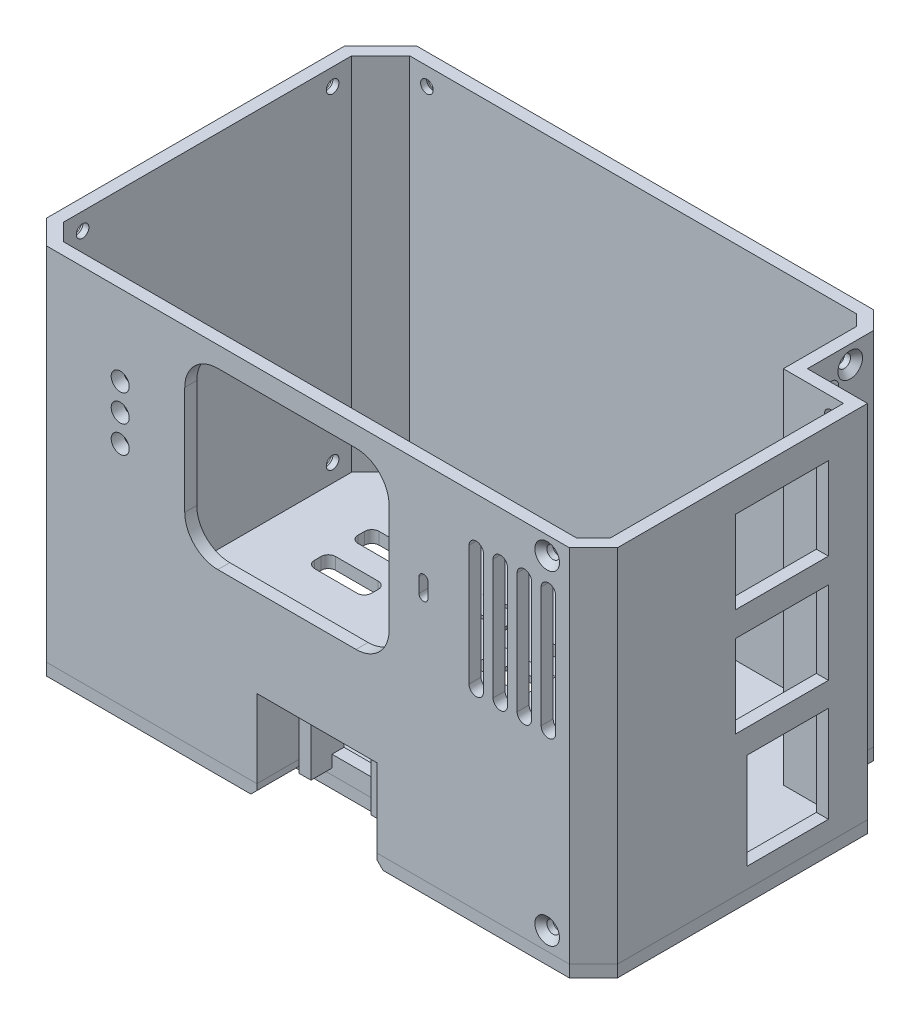
from build123d import *
from OCP.BRepFilletAPI import BRepFilletAPI_MakeChamfer

# Parameters (mm, degrees)
SKETCH_1_W           = 95
SKETCH_1_H           = 62
EXTRUDE_1_DEPTH      = 59.6
CUT_EXTRUDE_3_REACH  = 138.125
SKETCH_4_W           = 10
SKETCH_4_H           = 14
CHAMFER_2_SIZE       = 6
CHAMFER_3_SIZE       = 4
SKETCH_7_W           = 20
SKETCH_7_H           = 20
CUT_EXTRUDE_5_DEPTH  = 7.5
SHELL_3_T            = -2
SKETCH_9_W           = 20
SKETCH_9_H           = 5.5
CUT_EXTRUDE_6_DEPTH  = 10
SKETCH_10_W          = 20
SKETCH_10_H          = 2
EXTRUDE_2_DEPTH      = 5
SKETCH_11_W          = 34
SKETCH_11_H          = 29
CUT_EXTRUDE_7_DEPTH  = 34.5
FILLET_5_R           = 5.5
SKETCH_12_W          = 14
SKETCH_12_H          = 19
EXTRUDE_3_DEPTH      = 3.5
SKETCH_13_W          = 10
SKETCH_13_H          = 5.5
CUT_EXTRUDE_8_DEPTH  = 17
SKETCH_14_W          = 10
SKETCH_14_H          = 19
CUT_EXTRUDE_9_DEPTH  = 3.5
CHAMFER_4_SIZE       = 1
SKETCH_15_W          = 13.55
SKETCH_15_H          = 16
SKETCH_15_W_2        = 15.5
SKETCH_15_H_2        = 13.76
CUT_EXTRUDE_10_DEPTH = 2
CUT_EXTRUDE_11_DEPTH = 2
SKETCH_17_W          = 9.5
SKETCH_17_H          = 3.5
SKETCH_17_W_2        = 6.6
SKETCH_17_H_2        = 3.222886834
SKETCH_17_H_3        = 3.335283253
SKETCH_17_W_3        = 7
SKETCH_17_H_4        = 4.033222468
SKETCH_17_W_4        = 7.58
SKETCH_17_H_5        = 2.8
SKETCH_17_W_5        = 10.642604823
SKETCH_17_H_6        = 1.8
CUT_EXTRUDE_12_DEPTH = 2
CHAMFER_9_SIZE       = 1
FILLET_2_R           = 1.2
FILLET_3_R           = 0.5
CHAMFER_7_SIZE       = 1
SKETCH_18_R          = 1.5
CUT_EXTRUDE_13_DEPTH = 2
SKETCH_20_W          = 6.5
SKETCH_20_H          = 3.033222468
EXTRUDE_4_DEPTH      = 1
SKETCH_21_W          = 4
SKETCH_21_H          = 3.033222468
EXTRUDE_5_DEPTH      = 1
FILLET_4_R           = 0.5
CHAMFER_10_SIZE      = 1.8
CHAMFER_11_SIZE      = 3
CUT_EXTRUDE_15_REACH = 111.846
CUT_EXTRUDE_18_REACH = 119.755
SKETCH_29_R          = 1.05
CUT_EXTRUDE_19_REACH = 128.393
SKETCH_30_R          = 1.05
CUT_EXTRUDE_20_REACH = 111.846
SKETCH_31_R          = 1.05
CUT_EXTRUDE_21_REACH = 122.425
SKETCH_32_R          = 1.05
CUT_EXTRUDE_22_REACH = 128.393
SKETCH_33_R          = 1.05
CHAMFER_20_SIZE      = 1
CUT_EXTRUDE_26_REACH = 128.393
CHAMFER_21_SIZE      = 2
CHAMFER_21_SIZE2     = 9.409260219


# Read off the part's stored shape, not the designer's step: 分割1
with BuildPart() as part:
    # 草图1 → 凸台-拉伸1 (new body)
    with BuildSketch(Plane.XY):
        with Locations((-58.017381047, 4.902672836)):
            Rectangle(SKETCH_1_W, SKETCH_1_H)
    extrude(amount=EXTRUDE_1_DEPTH)

    # 草图4 → 切除-拉伸3 (cut, up to next)
    with BuildSketch(Plane.XZ.offset(26.097327164), mode=Mode.PRIVATE) as cut_extrude_3_sk1:
        with Locations((-15.517381047, 7)):
            Rectangle(SKETCH_4_W, SKETCH_4_H)
    cut_extrude_3_tool1 = extrude(cut_extrude_3_sk1.sketch, amount=-CUT_EXTRUDE_3_REACH, mode=Mode.PRIVATE) & part.part
    add(cut_extrude_3_tool1.solids().sort_by_distance((-15.517381, -26.097327, 7))[0], mode=Mode.SUBTRACT)

    # 倒角2
    chamfer_2_edges = [part.edges().sort_by_distance(p)[0] for p in [
        (-105.517381047, 4.902672836, 0),
    ]]
    chamfer(chamfer_2_edges, length=CHAMFER_2_SIZE)

    # 倒角3
    chamfer_3_edges = [part.edges().sort_by_distance(p)[0] for p in [
        (-10.517381047, 4.902672836, 59.6),
        (-105.517381047, 4.902672836, 59.6),
    ]]
    chamfer(chamfer_3_edges, length=CHAMFER_3_SIZE)

    # 草图7 → 切除-拉伸5 (cut)
    with BuildSketch(Plane.XY.offset(59.6)):
        with Locations((-56.517381047, -16.097327164)):
            Rectangle(SKETCH_7_W, SKETCH_7_H)
    extrude(amount=-CUT_EXTRUDE_5_DEPTH, mode=Mode.SUBTRACT)

    # 抽壳3
    shell_3_openings = [part.faces().sort_by_distance(p)[0] for p in [
        (-58.952330027, 35.902672836, 30.389820214),
    ]]
    offset(amount=SHELL_3_T, openings=shell_3_openings, kind=Kind.INTERSECTION)

    # 草图9 → 切除-拉伸6 (cut)
    with BuildSketch(Plane.XZ.offset(6.097327164)):
        with Locations((-56.517381047, 54.85)):
            Rectangle(SKETCH_9_W, SKETCH_9_H)
    extrude(amount=-CUT_EXTRUDE_6_DEPTH, mode=Mode.SUBTRACT)

    # 草图10 → 凸台-拉伸2 (add)
    with BuildSketch(Plane.XZ.offset(6.097327164)):
        with Locations((-56.517381047, 58.6)):
            Rectangle(SKETCH_10_W, SKETCH_10_H)
    extrude(amount=EXTRUDE_2_DEPTH)

    # 草图11 → 切除-拉伸7 (cut)
    with BuildSketch(Plane.XY.offset(59.6)):
        with Locations((-61.517381047, 18.002672836)):
            Rectangle(SKETCH_11_W, SKETCH_11_H)
    extrude(amount=-CUT_EXTRUDE_7_DEPTH, mode=Mode.SUBTRACT)

    # 圆角5
    fillet_5_edges = [part.edges().sort_by_distance(p)[0] for p in [
        (-44.517381047, 32.502672836, 58.6),
        (-44.517381047, 3.502672836, 58.6),
        (-78.517381047, 3.502672836, 58.6),
        (-78.517381047, 32.502672836, 58.6),
    ]]
    fillet(fillet_5_edges, radius=FILLET_5_R)

    # 草图12 → 凸台-拉伸3 (add)
    with BuildSketch(Plane.XY.offset(52.1)):
        with Locations((-56.517381047, -13.597327164)):
            Rectangle(SKETCH_12_W, SKETCH_12_H)
    extrude(amount=EXTRUDE_3_DEPTH)

    # 草图13 → 切除-拉伸8 (cut)
    with BuildSketch(Plane(origin=(0, -4.097327164, 0), x_dir=(1, 0, 0), z_dir=(0, 1, 0))):
        with Locations((-56.517381047, -52.85)):
            Rectangle(SKETCH_13_W, SKETCH_13_H)
    extrude(amount=-CUT_EXTRUDE_8_DEPTH, mode=Mode.SUBTRACT)

    # 草图14 → 切除-拉伸9 (cut)
    with BuildSketch(Plane.XY.offset(55.6)):
        with Locations((-56.517381047, -13.597327164)):
            Rectangle(SKETCH_14_W, SKETCH_14_H)
    extrude(amount=-CUT_EXTRUDE_9_DEPTH, mode=Mode.SUBTRACT)

    # 倒角4
    chamfer_4_edges = [part.edges().sort_by_distance(p)[0] for p in [
        (-46.517381047, -26.097327164, 55.85),
        (-66.517381047, -26.097327164, 55.85),
    ]]
    chamfer(chamfer_4_edges, length=CHAMFER_4_SIZE)

    # 草图15 → 切除-拉伸10 (cut)
    with BuildSketch(Plane(origin=(-10.517381047, 0, 0), x_dir=(0, 0, -1), z_dir=(1, 0, 0))):
        with Locations((-27.275, -12.777327164)):
            Rectangle(SKETCH_15_W, SKETCH_15_H)
        with Locations((-28.25, 6.122672836)):
            Rectangle(SKETCH_15_W_2, SKETCH_15_H_2)
        with Locations((-28.25, 24.022672836)):
            Rectangle(SKETCH_15_W_2, SKETCH_15_H_2)
    extrude(amount=-CUT_EXTRUDE_10_DEPTH, mode=Mode.SUBTRACT)

    # 草图16 → 切除-拉伸11 (cut)
    with BuildSketch(Plane.XY.offset(59.6)):
        with BuildLine():
            Line((-38.044404675, 19.202672836), (-38.044404675, 16.802672836))
            ThreePointArc((-38.044404675, 16.802672836), (-38.797381047, 16.049696464), (-39.55035742, 16.802672836))
            Line((-39.55035742, 16.802672836), (-39.55035742, 19.202672836))
            ThreePointArc((-39.55035742, 19.202672836), (-38.797381047, 19.955649209), (-38.044404675, 19.202672836))
        make_face()
    extrude(amount=-CUT_EXTRUDE_11_DEPTH, mode=Mode.SUBTRACT)

    # 草图17 → 切除-拉伸12 (cut)
    with BuildSketch(Plane.XZ.offset(26.097327164)):
        with Locations((-89.167381047, 14.816992129)):
            Rectangle(SKETCH_17_W, SKETCH_17_H)
        with Locations((-89.167381047, 22.061353331)):
            Rectangle(SKETCH_17_W, SKETCH_17_H)
        with Locations((-74.844770146, 21.922796748)):
            Rectangle(SKETCH_17_W_2, SKETCH_17_H_2)
        with Locations((-61.344770146, 21.978994958)):
            Rectangle(SKETCH_17_W_2, SKETCH_17_H_3)
        with Locations((-79.926338187, 15.083603363)):
            Rectangle(SKETCH_17_W_3, SKETCH_17_H_4)
        with Locations((-71.476338187, 15.083603363)):
            Rectangle(SKETCH_17_W_3, SKETCH_17_H_4)
        with Locations((-47.727381047, 15.166992129)):
            Rectangle(SKETCH_17_W_4, SKETCH_17_H_5)
        with Locations((-58.244603889, 15.666992129)):
            Rectangle(SKETCH_17_W_5, SKETCH_17_H_6)
    extrude(amount=-CUT_EXTRUDE_12_DEPTH, mode=Mode.SUBTRACT)

    # 倒角9
    chamfer_9_edges = [part.edges().sort_by_distance(p)[0] for p in [
        (-64.644770146, -24.097327164, 21.978994958),
        (-61.344770146, -24.097327164, 23.646636584),
        (-58.044770146, -24.097327164, 21.978994958),
        (-61.344770146, -24.097327164, 20.311353331),
        (-78.144770146, -24.097327164, 21.922796748),
        (-74.844770146, -24.097327164, 23.534240165),
        (-71.544770146, -24.097327164, 21.922796748),
        (-74.844770146, -24.097327164, 20.311353331),
        (-51.517381047, -24.097327164, 15.166992129),
        (-47.727381047, -24.097327164, 16.566992129),
        (-43.937381047, -24.097327164, 15.166992129),
        (-47.727381047, -24.097327164, 13.766992129),
    ]]
    chamfer(chamfer_9_edges, length=CHAMFER_9_SIZE)

    # 圆角2
    fillet_2_edges = [part.edges().sort_by_distance(p)[0] for p in [
        (-93.917381047, -25.097327164, 20.311353331),
        (-93.917381047, -25.097327164, 23.811353331),
        (-84.417381047, -25.097327164, 23.811353331),
        (-84.417381047, -25.097327164, 20.311353331),
        (-93.917381047, -25.097327164, 13.066992129),
        (-93.917381047, -25.097327164, 16.566992129),
        (-84.417381047, -25.097327164, 16.566992129),
        (-84.417381047, -25.097327164, 13.066992129),
    ]]
    fillet(fillet_2_edges, radius=FILLET_2_R)

    # 圆角3
    fillet_3_edges = [part.edges().sort_by_distance(p)[0] for p in [
        (-63.5659063, -25.097327164, 14.766992129),
        (-63.5659063, -25.097327164, 16.566992129),
        (-52.923301477, -25.097327164, 16.566992129),
        (-52.923301477, -25.097327164, 14.766992129),
        (-74.976338187, -25.097327164, 13.066992129),
        (-74.976338187, -25.097327164, 17.100214597),
        (-67.976338187, -25.097327164, 17.100214597),
        (-67.976338187, -25.097327164, 13.066992129),
        (-83.426338187, -25.097327164, 13.066992129),
        (-83.426338187, -25.097327164, 17.100214597),
        (-76.426338187, -25.097327164, 17.100214597),
        (-76.426338187, -25.097327164, 13.066992129),
        (-51.517381047, -25.597327164, 13.766992129),
        (-43.937381047, -25.597327164, 13.766992129),
        (-78.144770146, -25.597327164, 23.534240165),
        (-71.544770146, -25.597327164, 23.534240165),
        (-64.644770146, -25.597327164, 23.646636584),
        (-58.044770146, -25.597327164, 23.646636584),
    ]]
    fillet(fillet_3_edges, radius=FILLET_3_R)

    # 倒角7
    chamfer_7_edges = [part.edges().sort_by_distance(p)[0] for p in [
        (-51.517381047, -25.597327164, 16.566992129),
        (-43.937381047, -25.597327164, 16.566992129),
        (-78.144770146, -25.597327164, 20.311353331),
        (-71.544770146, -25.597327164, 20.311353331),
        (-64.644770146, -25.597327164, 20.311353331),
        (-58.044770146, -25.597327164, 20.311353331),
    ]]
    chamfer(chamfer_7_edges, length=CHAMFER_7_SIZE)

    # 草图18 → 切除-拉伸13 (cut)
    with BuildSketch(Plane.XY.offset(59.6)):
        with Locations((-89.256052289, 13.504339551)):
            Circle(SKETCH_18_R)
        with Locations((-89.256052289, 18.004339551)):
            Circle(SKETCH_18_R)
        with Locations((-89.256052289, 22.504339551)):
            Circle(SKETCH_18_R)
    extrude(amount=-CUT_EXTRUDE_13_DEPTH, mode=Mode.SUBTRACT)

    # 草图20 → 凸台-拉伸4 (add)
    with BuildSketch(Plane(origin=(0, -24.097327164, 0), x_dir=(1, 0, 0), z_dir=(0, 1, 0))):
        with Locations((-80.176338187, -15.083603363)):
            Rectangle(SKETCH_20_W, SKETCH_20_H)
        with Locations((-71.726338187, -15.083603363)):
            Rectangle(SKETCH_20_W, SKETCH_20_H)
    extrude(amount=-EXTRUDE_4_DEPTH)

    # 草图21 → 凸台-拉伸5 (add)
    with BuildSketch(Plane.XZ.offset(25.097327164)):
        with Locations((-78.926338187, 15.083603363)):
            Rectangle(SKETCH_21_W, SKETCH_21_H)
        with Locations((-70.476338187, 15.083603363)):
            Rectangle(SKETCH_21_W, SKETCH_21_H)
    extrude(amount=EXTRUDE_5_DEPTH)

    # 圆角4
    fillet_4_edges = [part.edges().sort_by_distance(p)[0] for p in [
        (-83.426338187, -25.097327164, 15.083603363),
        (-76.926338187, -25.097327164, 13.566992129),
        (-76.926338187, -25.097327164, 16.600214597),
        (-74.976338187, -25.097327164, 15.083603363),
        (-68.476338187, -25.097327164, 13.566992129),
        (-68.476338187, -25.097327164, 16.600214597),
        (-80.926338187, -25.597327164, 13.566992129),
        (-80.926338187, -25.597327164, 16.600214597),
        (-72.476338187, -25.597327164, 13.566992129),
        (-72.476338187, -25.597327164, 16.600214597),
    ]]
    fillet(fillet_4_edges, radius=FILLET_4_R)

    # 倒角10
    chamfer_10_edges = [part.edges().sort_by_distance(p)[0] for p in [
        (-22.517381047, 5.902672836, 2),
    ]]
    chamfer(chamfer_10_edges, length=CHAMFER_10_SIZE)

    # 倒角11
    chamfer_11_edges = [part.edges().sort_by_distance(p)[0] for p in [
        (-20.517381047, 4.902672836, 0),
    ]]
    chamfer(chamfer_11_edges, length=CHAMFER_11_SIZE)

    # 草图26 → 切除-拉伸15 (cut, up to next)
    with BuildSketch(Plane(origin=(-20.517381047, 0, 0), x_dir=(0, 0, -1), z_dir=(1, 0, 0)), mode=Mode.PRIVATE) as cut_extrude_15_sk1:
        with BuildLine():
            Line((-8.8, 30.902672836), (-8.8, -21.097327164))
            ThreePointArc((-8.8, -21.097327164), (-10, -22.297327164), (-11.2, -21.097327164))
            Line((-11.2, -21.097327164), (-11.2, 30.902672836))
            ThreePointArc((-11.2, 30.902672836), (-10, 32.102672836), (-8.8, 30.902672836))
        make_face()
    cut_extrude_15_tool1 = extrude(cut_extrude_15_sk1.sketch, amount=-CUT_EXTRUDE_15_REACH, mode=Mode.PRIVATE) & part.part
    add(cut_extrude_15_tool1.solids().sort_by_distance((-20.517381, 4.902673, 10))[0], mode=Mode.SUBTRACT)

    # 草图29 → 切除-拉伸18 (cut, up to next)
    with BuildSketch(Plane.ZY.offset(105.517381047), mode=Mode.PRIVATE) as cut_extrude_18_sk1:
        with Locations(Location((51.6, 33.052700784, 0), (0, 0, 270))):
            Circle(SKETCH_29_R)
    cut_extrude_18_tool1 = extrude(cut_extrude_18_sk1.sketch, amount=-CUT_EXTRUDE_18_REACH, mode=Mode.PRIVATE) & part.part
    # 草图29 → 切除-拉伸18 (cut, up to next)
    with BuildSketch(Plane.ZY.offset(105.517381047), mode=Mode.PRIVATE) as cut_extrude_18_sk2:
        with Locations(Location((51.6, -21.097327164, 0), (0, 0, 270))):
            Circle(SKETCH_29_R)
    cut_extrude_18_tool2 = extrude(cut_extrude_18_sk2.sketch, amount=-CUT_EXTRUDE_18_REACH, mode=Mode.PRIVATE) & part.part
    # 草图29 → 切除-拉伸18 (cut, up to next)
    with BuildSketch(Plane.ZY.offset(105.517381047), mode=Mode.PRIVATE) as cut_extrude_18_sk3:
        with Locations(Location((10, 33.052700784, 0), (0, 0, 270))):
            Circle(SKETCH_29_R)
    cut_extrude_18_tool3 = extrude(cut_extrude_18_sk3.sketch, amount=-CUT_EXTRUDE_18_REACH, mode=Mode.PRIVATE) & part.part
    # 草图29 → 切除-拉伸18 (cut, up to next)
    with BuildSketch(Plane.ZY.offset(105.517381047), mode=Mode.PRIVATE) as cut_extrude_18_sk4:
        with Locations(Location((10, -21.097327164, 0), (0, 0, 270))):
            Circle(SKETCH_29_R)
    cut_extrude_18_tool4 = extrude(cut_extrude_18_sk4.sketch, amount=-CUT_EXTRUDE_18_REACH, mode=Mode.PRIVATE) & part.part
    add(cut_extrude_18_tool1.solids().sort_by_distance((-105.517381, 33.052701, 51.6))[0], mode=Mode.SUBTRACT)
    add(cut_extrude_18_tool2.solids().sort_by_distance((-105.517381, -21.097327, 51.6))[0], mode=Mode.SUBTRACT)
    add(cut_extrude_18_tool3.solids().sort_by_distance((-105.517381, 33.052701, 10))[0], mode=Mode.SUBTRACT)
    add(cut_extrude_18_tool4.solids().sort_by_distance((-105.517381, -21.097327, 10))[0], mode=Mode.SUBTRACT)

    # 草图30 → 切除-拉伸19 (cut, up to next)
    with BuildSketch(Plane(origin=(0, 0, 0), x_dir=(-1, 0, 0), z_dir=(0, 0, -1)), mode=Mode.PRIVATE) as cut_extrude_19_sk1:
        with Locations((95.819105442, 32.902672836)):
            Circle(SKETCH_30_R)
    cut_extrude_19_tool1 = extrude(cut_extrude_19_sk1.sketch, amount=-CUT_EXTRUDE_19_REACH, mode=Mode.PRIVATE) & part.part
    # 草图30 → 切除-拉伸19 (cut, up to next)
    with BuildSketch(Plane(origin=(0, 0, 0), x_dir=(-1, 0, 0), z_dir=(0, 0, -1)), mode=Mode.PRIVATE) as cut_extrude_19_sk2:
        with Locations((95.819105442, -21.097327164)):
            Circle(SKETCH_30_R)
    cut_extrude_19_tool2 = extrude(cut_extrude_19_sk2.sketch, amount=-CUT_EXTRUDE_19_REACH, mode=Mode.PRIVATE) & part.part
    add(cut_extrude_19_tool1.solids().sort_by_distance((-95.819105, 32.902673, 0))[0], mode=Mode.SUBTRACT)
    add(cut_extrude_19_tool2.solids().sort_by_distance((-95.819105, -21.097327, 0))[0], mode=Mode.SUBTRACT)

    # 草图31 → 切除-拉伸20 (cut, up to next)
    with BuildSketch(Plane(origin=(-20.517381047, 0, 0), x_dir=(0, 0, -1), z_dir=(1, 0, 0)), mode=Mode.PRIVATE) as cut_extrude_20_sk1:
        with Locations((-6.869848481, 32.902672836)):
            Circle(SKETCH_31_R)
    cut_extrude_20_tool1 = extrude(cut_extrude_20_sk1.sketch, amount=-CUT_EXTRUDE_20_REACH, mode=Mode.PRIVATE) & part.part
    # 草图31 → 切除-拉伸20 (cut, up to next)
    with BuildSketch(Plane(origin=(-20.517381047, 0, 0), x_dir=(0, 0, -1), z_dir=(1, 0, 0)), mode=Mode.PRIVATE) as cut_extrude_20_sk2:
        with Locations((-6.869848481, -21.097327164)):
            Circle(SKETCH_31_R)
    cut_extrude_20_tool2 = extrude(cut_extrude_20_sk2.sketch, amount=-CUT_EXTRUDE_20_REACH, mode=Mode.PRIVATE) & part.part
    add(cut_extrude_20_tool1.solids().sort_by_distance((-20.517381, 32.902673, 6.869848))[0], mode=Mode.SUBTRACT)
    add(cut_extrude_20_tool2.solids().sort_by_distance((-20.517381, -21.097327, 6.869848))[0], mode=Mode.SUBTRACT)

    # 草图32 → 切除-拉伸21 (cut, up to next)
    with BuildSketch(Plane(origin=(0, 0, 14), x_dir=(-1, 0, 0), z_dir=(0, 0, -1)), mode=Mode.PRIVATE) as cut_extrude_21_sk1:
        with Locations((14.617381047, 32.902672836)):
            Circle(SKETCH_32_R)
    cut_extrude_21_tool1 = extrude(cut_extrude_21_sk1.sketch, amount=-CUT_EXTRUDE_21_REACH, mode=Mode.PRIVATE) & part.part
    # 草图32 → 切除-拉伸21 (cut, up to next)
    with BuildSketch(Plane(origin=(0, 0, 14), x_dir=(-1, 0, 0), z_dir=(0, 0, -1)), mode=Mode.PRIVATE) as cut_extrude_21_sk2:
        with Locations((14.617381047, -21.097327164)):
            Circle(SKETCH_32_R)
    cut_extrude_21_tool2 = extrude(cut_extrude_21_sk2.sketch, amount=-CUT_EXTRUDE_21_REACH, mode=Mode.PRIVATE) & part.part
    add(cut_extrude_21_tool1.solids().sort_by_distance((-14.617381, 32.902673, 14))[0], mode=Mode.SUBTRACT)
    add(cut_extrude_21_tool2.solids().sort_by_distance((-14.617381, -21.097327, 14))[0], mode=Mode.SUBTRACT)

    # 草图33 → 切除-拉伸22 (cut, up to next)
    with BuildSketch(Plane.XY.offset(59.6), mode=Mode.PRIVATE) as cut_extrude_22_sk1:
        with Locations((-18.215656653, 32.902672836)):
            Circle(SKETCH_33_R)
    cut_extrude_22_tool1 = extrude(cut_extrude_22_sk1.sketch, amount=-CUT_EXTRUDE_22_REACH, mode=Mode.PRIVATE) & part.part
    # 草图33 → 切除-拉伸22 (cut, up to next)
    with BuildSketch(Plane.XY.offset(59.6), mode=Mode.PRIVATE) as cut_extrude_22_sk2:
        with Locations((-18.215656653, -21.097327164)):
            Circle(SKETCH_33_R)
    cut_extrude_22_tool2 = extrude(cut_extrude_22_sk2.sketch, amount=-CUT_EXTRUDE_22_REACH, mode=Mode.PRIVATE) & part.part
    add(cut_extrude_22_tool1.solids().sort_by_distance((-18.215657, 32.902673, 59.6))[0], mode=Mode.SUBTRACT)
    add(cut_extrude_22_tool2.solids().sort_by_distance((-18.215657, -21.097327, 59.6))[0], mode=Mode.SUBTRACT)

    # 倒角20
    # the kernel refuses this chamfer: 1 mm, written as the material it takes off along each edge
    with BuildSketch(Plane(origin=(-105.517381047, 33.052700784, 10), x_dir=(0, -1, 0), z_dir=(0, 0, -1))) as chamfer_20_piece_1:
        Polygon((1.05 + CHAMFER_20_SIZE, 0), (1.05, -CHAMFER_20_SIZE), (1.05, 0), align=None)
    revolve(axis=Axis((-105.517381047, 33.052700784, 10), (-1, 0, 0)), mode=Mode.SUBTRACT)
    with BuildSketch(Plane(origin=(-105.517381047, -21.097327164, 10), x_dir=(0, -1, 0), z_dir=(0, 0, -1))) as chamfer_20_piece_2:
        Polygon((1.05 + CHAMFER_20_SIZE, 0), (1.05, -CHAMFER_20_SIZE), (1.05, 0), align=None)
    revolve(axis=Axis((-105.517381047, -21.097327164, 10), (-1, 0, 0)), mode=Mode.SUBTRACT)
    with BuildSketch(Plane(origin=(-105.517381047, -21.097327164, 51.6), x_dir=(0, -1, 0), z_dir=(0, 0, -1))) as chamfer_20_piece_3:
        Polygon((1.05 + CHAMFER_20_SIZE, 0), (1.05, -CHAMFER_20_SIZE), (1.05, 0), align=None)
    revolve(axis=Axis((-105.517381047, -21.097327164, 51.6), (-1, 0, 0)), mode=Mode.SUBTRACT)
    with BuildSketch(Plane(origin=(-105.517381047, 33.052700784, 51.6), x_dir=(0, -1, 0), z_dir=(0, 0, -1))) as chamfer_20_piece_4:
        Polygon((1.05 + CHAMFER_20_SIZE, 0), (1.05, -CHAMFER_20_SIZE), (1.05, 0), align=None)
    revolve(axis=Axis((-105.517381047, 33.052700784, 51.6), (-1, 0, 0)), mode=Mode.SUBTRACT)
    with BuildSketch(Plane(origin=(-95.819105442, 32.902672836, 0), x_dir=(-1, 0, 0), z_dir=(0, -1, 0))) as chamfer_20_piece_5:
        Polygon((1.05 + CHAMFER_20_SIZE, 0), (1.05, -CHAMFER_20_SIZE), (1.05, 0), align=None)
    revolve(axis=Axis((-95.819105442, 32.902672836, 0), (0, 0, -1)), mode=Mode.SUBTRACT)
    with BuildSketch(Plane(origin=(-95.819105442, -21.097327164, 0), x_dir=(-1, 0, 0), z_dir=(0, -1, 0))) as chamfer_20_piece_6:
        Polygon((1.05 + CHAMFER_20_SIZE, 0), (1.05, -CHAMFER_20_SIZE), (1.05, 0), align=None)
    revolve(axis=Axis((-95.819105442, -21.097327164, 0), (0, 0, -1)), mode=Mode.SUBTRACT)
    with BuildSketch(Plane(origin=(-20.517381047, 32.902672836, 6.869848481), x_dir=(0, 0, -1), z_dir=(0, -1, 0))) as chamfer_20_piece_7:
        Polygon((1.05 + CHAMFER_20_SIZE, 0), (1.05, -CHAMFER_20_SIZE), (1.05, 0), align=None)
    revolve(axis=Axis((-20.517381047, 32.902672836, 6.869848481), (1, 0, 0)), mode=Mode.SUBTRACT)
    with BuildSketch(Plane(origin=(-20.517381047, -21.097327164, 6.869848481), x_dir=(0, 0, -1), z_dir=(0, -1, 0))) as chamfer_20_piece_8:
        Polygon((1.05 + CHAMFER_20_SIZE, 0), (1.05, -CHAMFER_20_SIZE), (1.05, 0), align=None)
    revolve(axis=Axis((-20.517381047, -21.097327164, 6.869848481), (1, 0, 0)), mode=Mode.SUBTRACT)
    with BuildSketch(Plane(origin=(-14.617381047, 32.902672836, 14), x_dir=(-1, 0, 0), z_dir=(0, -1, 0))) as chamfer_20_piece_9:
        Polygon((1.05 + CHAMFER_20_SIZE, 0), (1.05, -CHAMFER_20_SIZE), (1.05, 0), align=None)
    revolve(axis=Axis((-14.617381047, 32.902672836, 14), (0, 0, -1)), mode=Mode.SUBTRACT)
    with BuildSketch(Plane(origin=(-14.617381047, -21.097327164, 14), x_dir=(-1, 0, 0), z_dir=(0, -1, 0))) as chamfer_20_piece_10:
        Polygon((1.05 + CHAMFER_20_SIZE, 0), (1.05, -CHAMFER_20_SIZE), (1.05, 0), align=None)
    revolve(axis=Axis((-14.617381047, -21.097327164, 14), (0, 0, -1)), mode=Mode.SUBTRACT)
    with BuildSketch(Plane(origin=(-18.215656653, 32.902672836, 59.6), x_dir=(1, 0, 0), z_dir=(0, -1, 0))) as chamfer_20_piece_11:
        Polygon((1.05 + CHAMFER_20_SIZE, 0), (1.05, -CHAMFER_20_SIZE), (1.05, 0), align=None)
    revolve(axis=Axis((-18.215656653, 32.902672836, 59.6), (0, 0, 1)), mode=Mode.SUBTRACT)
    with BuildSketch(Plane(origin=(-18.215656653, -21.097327164, 59.6), x_dir=(1, 0, 0), z_dir=(0, -1, 0))) as chamfer_20_piece_12:
        Polygon((1.05 + CHAMFER_20_SIZE, 0), (1.05, -CHAMFER_20_SIZE), (1.05, 0), align=None)
    revolve(axis=Axis((-18.215656653, -21.097327164, 59.6), (0, 0, 1)), mode=Mode.SUBTRACT)

    # 草图27 → 切除-拉伸26 (cut, up to next)
    with BuildSketch(Plane.XY.offset(59.6), mode=Mode.PRIVATE) as cut_extrude_26_sk1:
        with BuildLine():
            Line((-16.817381047, 27.902672836), (-16.817381047, 7.902672836))
            ThreePointArc((-16.817381047, 7.902672836), (-18.017381047, 6.702672836), (-19.217381047, 7.902672836))
            Line((-19.217381047, 7.902672836), (-19.217381047, 27.902672836))
            ThreePointArc((-19.217381047, 27.902672836), (-18.017381047, 29.102672836), (-16.817381047, 27.902672836))
        make_face()
    cut_extrude_26_tool1 = extrude(cut_extrude_26_sk1.sketch, amount=-CUT_EXTRUDE_26_REACH, mode=Mode.PRIVATE) & part.part
    # 草图27 → 切除-拉伸26 (cut, up to next)
    with BuildSketch(Plane.XY.offset(59.6), mode=Mode.PRIVATE) as cut_extrude_26_sk2:
        with BuildLine():
            Line((-20.817381047, 27.902672836), (-20.817381047, 7.902672836))
            ThreePointArc((-20.817381047, 7.902672836), (-22.017381047, 6.702672836), (-23.217381047, 7.902672836))
            Line((-23.217381047, 7.902672836), (-23.217381047, 27.902672836))
            ThreePointArc((-23.217381047, 27.902672836), (-22.017381047, 29.102672836), (-20.817381047, 27.902672836))
        make_face()
    cut_extrude_26_tool2 = extrude(cut_extrude_26_sk2.sketch, amount=-CUT_EXTRUDE_26_REACH, mode=Mode.PRIVATE) & part.part
    # 草图27 → 切除-拉伸26 (cut, up to next)
    with BuildSketch(Plane.XY.offset(59.6), mode=Mode.PRIVATE) as cut_extrude_26_sk3:
        with BuildLine():
            Line((-24.817381047, 27.902672836), (-24.817381047, 7.902672836))
            ThreePointArc((-24.817381047, 7.902672836), (-26.017381047, 6.702672836), (-27.217381047, 7.902672836))
            Line((-27.217381047, 7.902672836), (-27.217381047, 27.902672836))
            ThreePointArc((-27.217381047, 27.902672836), (-26.017381047, 29.102672836), (-24.817381047, 27.902672836))
        make_face()
    cut_extrude_26_tool3 = extrude(cut_extrude_26_sk3.sketch, amount=-CUT_EXTRUDE_26_REACH, mode=Mode.PRIVATE) & part.part
    # 草图27 → 切除-拉伸26 (cut, up to next)
    with BuildSketch(Plane.XY.offset(59.6), mode=Mode.PRIVATE) as cut_extrude_26_sk4:
        with BuildLine():
            Line((-28.817381047, 27.902672836), (-28.817381047, 7.902672836))
            ThreePointArc((-28.817381047, 7.902672836), (-30.017381047, 6.702672836), (-31.217381047, 7.902672836))
            Line((-31.217381047, 7.902672836), (-31.217381047, 27.902672836))
            ThreePointArc((-31.217381047, 27.902672836), (-30.017381047, 29.102672836), (-28.817381047, 27.902672836))
        make_face()
    cut_extrude_26_tool4 = extrude(cut_extrude_26_sk4.sketch, amount=-CUT_EXTRUDE_26_REACH, mode=Mode.PRIVATE) & part.part
    add(cut_extrude_26_tool1.solids().sort_by_distance((-18.017381, 17.902673, 59.6))[0], mode=Mode.SUBTRACT)
    add(cut_extrude_26_tool2.solids().sort_by_distance((-22.017381, 17.902673, 59.6))[0], mode=Mode.SUBTRACT)
    add(cut_extrude_26_tool3.solids().sort_by_distance((-26.017381, 17.902673, 59.6))[0], mode=Mode.SUBTRACT)
    add(cut_extrude_26_tool4.solids().sort_by_distance((-30.017381, 17.902673, 59.6))[0], mode=Mode.SUBTRACT)

    # 倒角21: one chamfer whose edges measure the first distance from different faces: ONE call of the kernel's chamfer builder (chamfer() names one face for all edges)
    chamfer_21_edges_1 = [part.edges().sort_by_distance(p)[0] for p in [
        (-50.517381047, -4.097327164, 55.6),
    ]]
    chamfer_21_side_1 = [part.faces().sort_by_distance(p)[0] for p in [
        (-44.61997247, -4.097327164, 53.85),
    ]]
    chamfer_21_edges_2 = [part.edges().sort_by_distance(p)[0] for p in [
        (-62.517381047, -4.097327164, 55.6),
    ]]
    chamfer_21_side_2 = [part.faces().sort_by_distance(p)[0] for p in [
        (-65.017381047, -4.097327164, 50.202591423),
    ]]
    chamfer_21 = BRepFilletAPI_MakeChamfer(part.part.solid().wrapped)
    for e in chamfer_21_edges_1:
        chamfer_21.Add(CHAMFER_21_SIZE, CHAMFER_21_SIZE2, e.wrapped, chamfer_21_side_1[0].wrapped)  # the first distance lies on this face
    for e in chamfer_21_edges_2:
        chamfer_21.Add(CHAMFER_21_SIZE, CHAMFER_21_SIZE2, e.wrapped, chamfer_21_side_2[0].wrapped)  # the first distance lies on this face
    add(Compound.cast(chamfer_21.Shape()), mode=Mode.REPLACE)


with BuildPart() as body_2:
    # Split Bodies 1: the piece on the far side of the plane
    add(part.part)
    split(bisect_by=Plane(origin=(0, -24.097327164, 0), x_dir=(1, 0, 0), z_dir=(0, 1, 0)), keep=Keep.BOTTOM)


with BuildPart() as part_1:
    add(part.part)

    # Split Bodies 1
    split(bisect_by=Plane(origin=(0, -24.097327164, 0), x_dir=(1, 0, 0), z_dir=(0, 1, 0)), keep=Keep.TOP)


solid = Compound([body_2.part, part_1.part])
